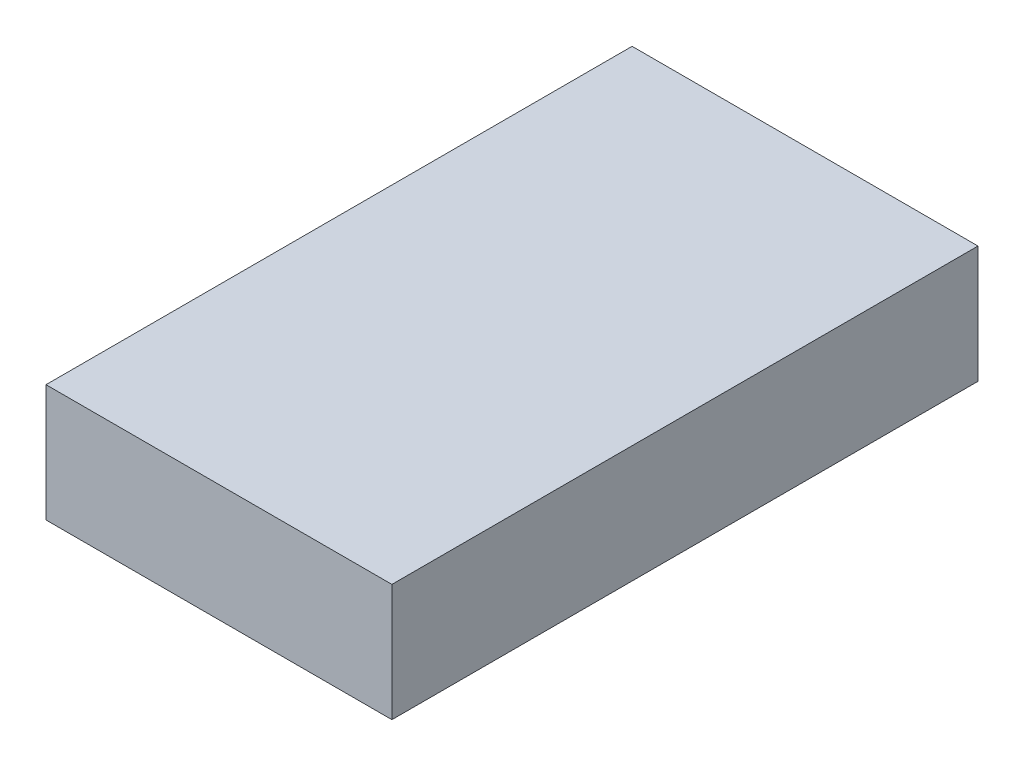
from build123d import *

# Parameters (mm, degrees)
SKETCH1_W           = 29.520850198
SKETCH1_H           = 50.018346185
BOSS_EXTRUDE1_DEPTH = 10


with BuildPart() as part:
    # Sketch1 → Boss-Extrude1 (new body)
    with BuildSketch(Plane(origin=(0, 0, 0), x_dir=(1, 0, 0), z_dir=(0, 1, 0))):
        with Locations((14.760425099, 25.009173093)):
            Rectangle(SKETCH1_W, SKETCH1_H)
    extrude(amount=BOSS_EXTRUDE1_DEPTH)


solid = part.part
